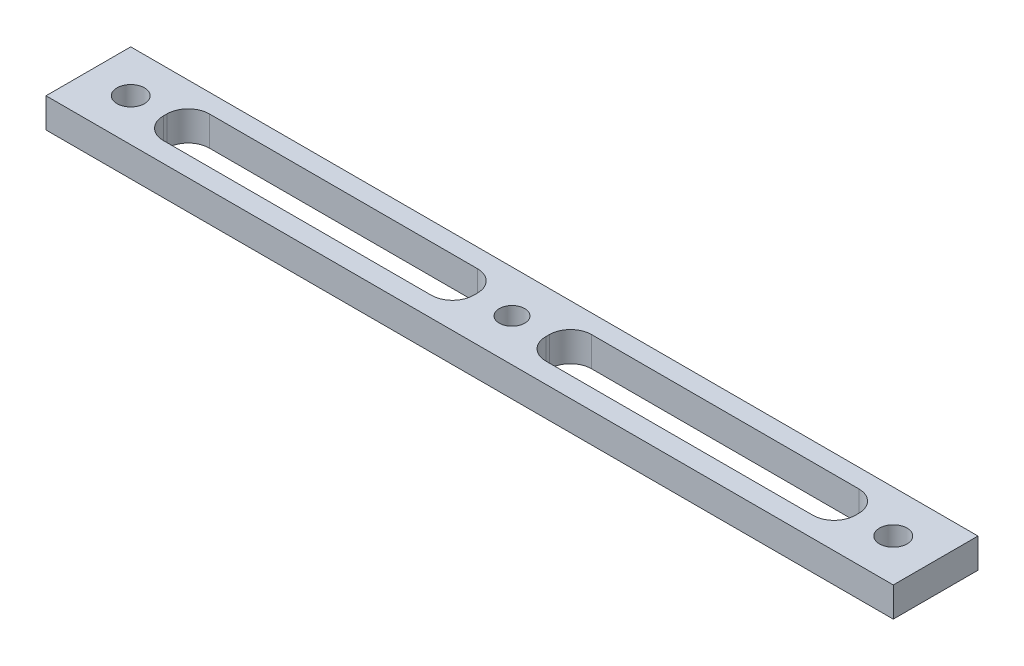
from build123d import *

# Parameters (mm, degrees)
SZKIC1_R                    = 3.25
DODANIE_WYCI_GNI_CIE1_DEPTH = 7


with BuildPart() as part:
    # Szkic1 → Dodanie-wyciągnięcie1 (new body)
    with BuildSketch(Plane(origin=(0, 0, 0), x_dir=(1, 0, 0), z_dir=(0, 1, 0))):
        Polygon((0, 0), (100, 0), (200, 0), (200, 10), (200, 20), (0, 20), (0, 10), align=None)
        with BuildLine():
            ThreePointArc((103, 10), (102.121320344, 7.878679656), (100, 7))
            ThreePointArc((100, 7), (97.878679656, 12.121320344), (103, 10))
        make_face(mode=Mode.SUBTRACT)
        with Locations((190, 10)):
            Circle(SZKIC1_R, mode=Mode.SUBTRACT)
        with BuildLine():
            ThreePointArc((13.25, 10), (10, 6.75), (6.75, 10))
            ThreePointArc((6.75, 10), (10, 13.25), (13.25, 10))
        make_face(mode=Mode.SUBTRACT)
        with BuildLine():
            ThreePointArc((17.984822323, 10.57457628), (19.449288417, 14.110110186), (22.984822323, 15.57457628))
            Line((22.984822323, 15.57457628), (86.25939238, 15.57457628))
            ThreePointArc((86.25939238, 15.57457628), (89.794926286, 14.110110186), (91.25939238, 10.57457628))
            Line((91.25939238, 10.57457628), (91.25939238, 9.696719379))
            ThreePointArc((91.25939238, 9.696719379), (89.794926286, 6.161185473), (86.25939238, 4.696719379))
            Line((86.25939238, 4.696719379), (22.984822323, 4.696719379))
            ThreePointArc((22.984822323, 4.696719379), (19.449288417, 6.161185473), (17.984822323, 9.696719379))
            Line((17.984822323, 9.696719379), (17.984822323, 10.57457628))
        make_face(mode=Mode.SUBTRACT)
        with BuildLine():
            ThreePointArc((108.225148066, 10.57457628), (109.68961416, 14.110110186), (113.225148066, 15.57457628))
            Line((113.225148066, 15.57457628), (176.286209663, 15.57457628))
            ThreePointArc((176.286209663, 15.57457628), (179.821743569, 14.110110186), (181.286209663, 10.57457628))
            Line((181.286209663, 10.57457628), (181.286209663, 9.752776346))
            ThreePointArc((181.286209663, 9.752776346), (179.821743569, 6.21724244), (176.286209663, 4.752776346))
            Line((176.286209663, 4.752776346), (113.225148066, 4.752776346))
            ThreePointArc((113.225148066, 4.752776346), (109.68961416, 6.21724244), (108.225148066, 9.752776346))
            Line((108.225148066, 9.752776346), (108.225148066, 10.57457628))
        make_face(mode=Mode.SUBTRACT)
    extrude(amount=DODANIE_WYCI_GNI_CIE1_DEPTH)


solid = part.part
